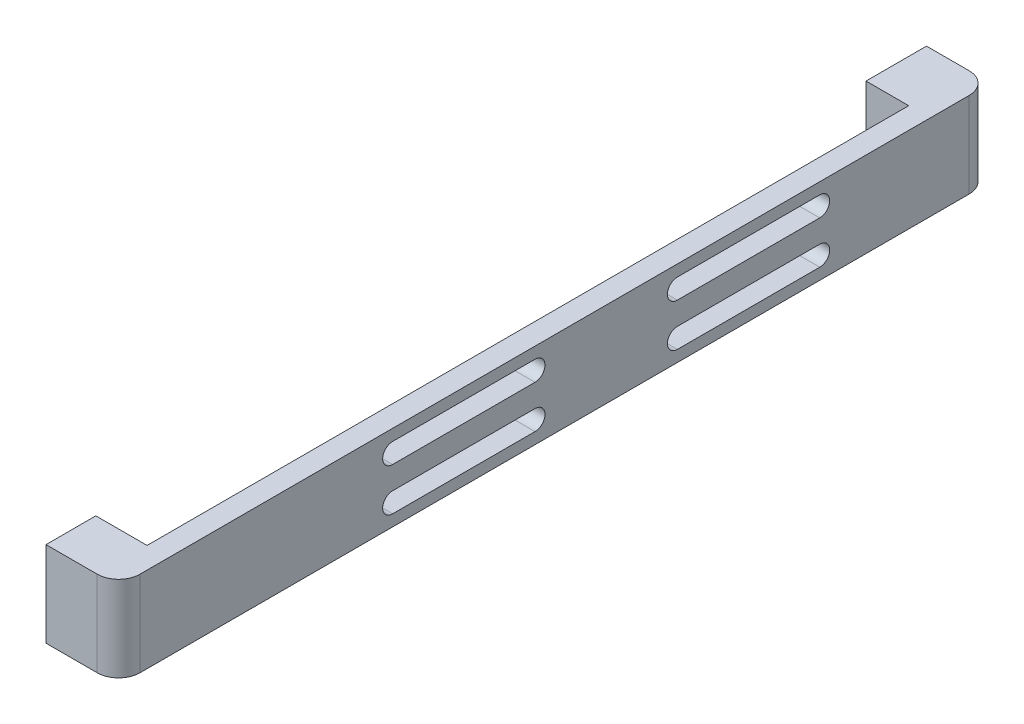
from build123d import *

# Parameters (mm, degrees)
SKETCH1_W             = 8.5
SKETCH1_H             = 12
BOSS_EXTRUDE1_DEPTH   = 5
SKETCH1_W_2           = 7
BOSS_EXTRUDE1_2_DEPTH = 5
SKETCH3_W             = 122.5
SKETCH3_H             = 12
BOSS_EXTRUDE2_DEPTH   = 3
CUT_EXTRUDE1_DEPTH    = 3
FILLET1_R             = 3
SKETCH5_W             = 7
SKETCH5_H             = 12
BOSS_EXTRUDE3_DEPTH   = 2.2
SKETCH6_W             = 8.5
SKETCH6_H             = 12
BOSS_EXTRUDE4_DEPTH   = 1


with BuildPart() as part:
    # Sketch1 → Boss-Extrude1 (new body)
    with BuildSketch(Plane(origin=(0, 0, 0), x_dir=(0, 0, -1), z_dir=(1, 0, 0))):
        with Locations((57.75, 0)):
            Rectangle(SKETCH1_W, SKETCH1_H)
    extrude(amount=BOSS_EXTRUDE1_DEPTH)



with BuildPart() as body_2:
    # Sketch1 → Boss-Extrude1 2 (new body)
    with BuildSketch(Plane(origin=(0, 0, 0), x_dir=(0, 0, -1), z_dir=(1, 0, 0))):
        with Locations((-57, 0)):
            Rectangle(SKETCH1_W_2, SKETCH1_H)
    extrude(amount=BOSS_EXTRUDE1_2_DEPTH)


with BuildPart() as part_1:
    add(part.part)

    add(body_2.part)  # Boss-Extrude2 merges body 2
    # Sketch3 → Boss-Extrude2 (add)
    with BuildSketch(Plane(origin=(5, 0, 0), x_dir=(0, 0, -1), z_dir=(1, 0, 0))):
        with Locations((0.75, 0)):
            Rectangle(SKETCH3_W, SKETCH3_H)
    extrude(amount=BOSS_EXTRUDE2_DEPTH)

    # Sketch4 → Cut-Extrude1 (cut)
    with BuildSketch(Plane(origin=(8, 0, 0), x_dir=(0, 0, -1), z_dir=(1, 0, 0))):
        with BuildLine():
            ThreePointArc((-22, 4.4), (-23.4, 3), (-22, 1.6))
            Line((-22, 1.6), (-2, 1.6))
            ThreePointArc((-2, 1.6), (-0.6, 3), (-2, 4.4))
            Line((-2, 4.4), (-22, 4.4))
        make_face()
        with BuildLine():
            ThreePointArc((38, 1.6), (39.4, 3), (38, 4.4))
            Line((38, 4.4), (18, 4.4))
            ThreePointArc((18, 4.4), (16.6, 3), (18, 1.6))
            Line((18, 1.6), (38, 1.6))
        make_face()
        with BuildLine():
            ThreePointArc((38, -4.4), (39.4, -3), (38, -1.6))
            Line((38, -1.6), (18, -1.6))
            ThreePointArc((18, -1.6), (16.6, -3), (18, -4.4))
            Line((18, -4.4), (38, -4.4))
        make_face()
        with BuildLine():
            ThreePointArc((-22, -1.6), (-23.4, -3), (-22, -4.4))
            Line((-22, -4.4), (-2, -4.4))
            ThreePointArc((-2, -4.4), (-0.6, -3), (-2, -1.6))
            Line((-2, -1.6), (-22, -1.6))
        make_face()
    extrude(amount=-CUT_EXTRUDE1_DEPTH, mode=Mode.SUBTRACT)

    # Fillet1
    fillet1_edges = [part_1.edges().sort_by_distance(p)[0] for p in [
        (8, 0, -62),
        (8, 0, 60.5),
    ]]
    fillet(fillet1_edges, radius=FILLET1_R)

    # Sketch5 → Boss-Extrude3 (add)
    with BuildSketch(Plane.ZY):
        with Locations((57, 0)):
            Rectangle(SKETCH5_W, SKETCH5_H)
    extrude(amount=BOSS_EXTRUDE3_DEPTH)

    # Sketch6 → Boss-Extrude4 (add)
    with BuildSketch(Plane.ZY):
        with Locations((-57.75, 0)):
            Rectangle(SKETCH6_W, SKETCH6_H)
    extrude(amount=BOSS_EXTRUDE4_DEPTH)


solid = part_1.part
